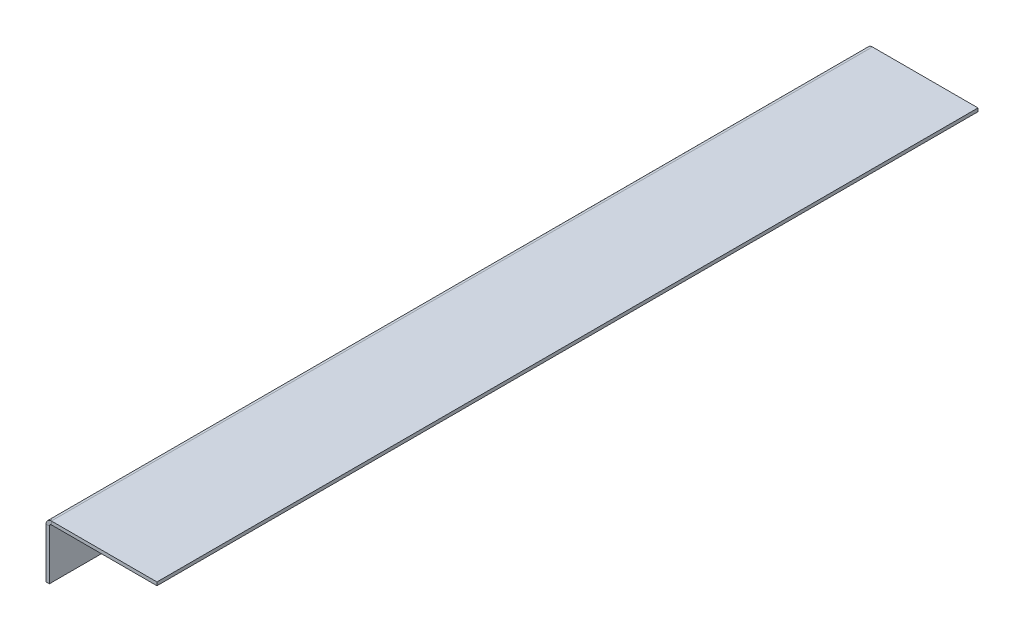
from build123d import *

# Parameters (mm, degrees)
BASE_FLANGE1_DEPTH = 296


# Sheet-metal steps are written as plain solids
with BuildPart() as part:
    # Sketch1 → Base-Flange1 (new body)
    with BuildSketch(Plane.XY):
        with BuildLine():
            Line((0, 0), (0, 18.0634))
            ThreePointArc((0, 18.0634), (0.567217008, 19.432782992), (1.9366, 20))
            Line((1.9366, 20), (40, 20))
            Line((40, 20), (40, 18.8))
            Line((40, 18.8), (1.9366, 18.8))
            ThreePointArc((1.9366, 18.8), (1.415745145, 18.584254855), (1.2, 18.0634))
            Line((1.2, 18.0634), (1.2, 0))
            Line((1.2, 0), (0, 0))
        make_face()
    extrude(amount=BASE_FLANGE1_DEPTH)


solid = part.part
